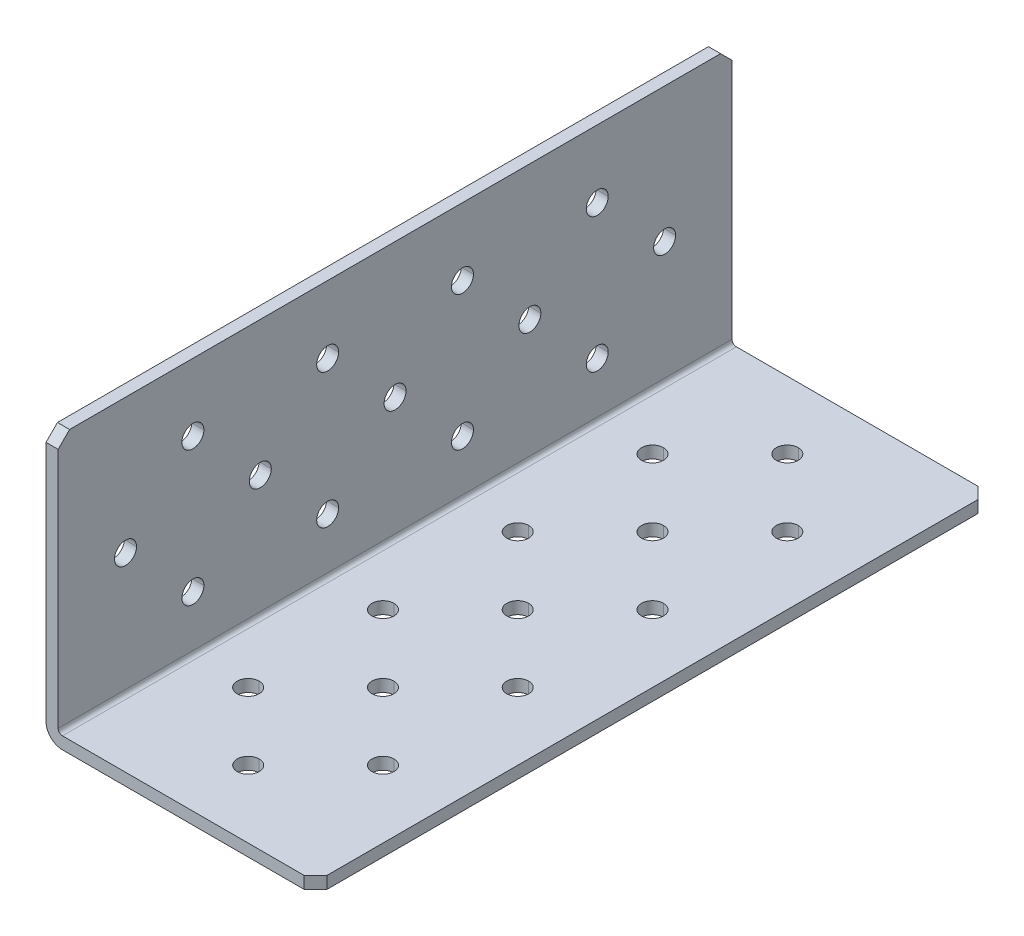
from build123d import *

# Parameters (mm, degrees)
CUT_EXTRUDE1_OUTLINE_R   = 2.0701
CUT_EXTRUDE1_DEPTH       = 3.0988
CUT_EXTRUDE1_START       = 2.286
CUT_EXTRUDE1_2_OUTLINE_W = 2.286
CUT_EXTRUDE1_2_OUTLINE_H = 152.4
CUT_EXTRUDE1_2_DEPTH     = 48.514
CUT_EXTRUDE1_START_2     = 3.0988
CUT_EXTRUDE1_3_OUTLINE_W = 0.8128
CUT_EXTRUDE1_3_OUTLINE_H = 152.4
CUT_EXTRUDE1_3_DEPTH     = 47.7012
CUT_EXTRUDE1_4_OUTLINE_R = 2.0701
CUT_EXTRUDE1_4_DEPTH     = 2.286
CUT_EXTRUDE1_START_3     = -749.3
CUT_EXTRUDE1_5_DEPTH     = 152.4
CUT_EXTRUDE1_START_4     = 564.229492087
CUT_EXTRUDE1_6_OUTLINE_W = 5
CUT_EXTRUDE1_6_OUTLINE_H = 6
CUT_EXTRUDE1_6_DEPTH     = 2.770507913
CHAMFER1_SIZE            = 2.159
BOSS_EXTRUDE1_START      = -2.286
BOSS_EXTRUDE1_DEPTH      = 2.286
BOSS_EXTRUDE2_START      = -2.286
BOSS_EXTRUDE2_DEPTH      = 2.286
SKETCH4_W                = 50.8
SKETCH4_H                = 50.8
CUT_EXTRUDE2_DEPTH       = 12.7
SKETCH5_W                = 50.8
SKETCH5_H                = 50.8
CUT_EXTRUDE3_DEPTH       = 12.7
BOSS_EXTRUDE3_START      = -2.286
BOSS_EXTRUDE3_DEPTH      = 2.286
BOSS_EXTRUDE4_START      = -2.286
BOSS_EXTRUDE4_DEPTH      = 2.286
CHAMFER2_SIZE            = 2.159


with BuildPart() as part:
    # Cut-Extrude1: read off the stored shape, not the designer's step
    # Cut-Extrude1 outline → Cut-Extrude1 (new body)
    with BuildSketch(Plane(origin=(0, 0, 0), x_dir=(1, 0, 0), z_dir=(0, 1, 0))):
        with BuildLine():
            ThreePointArc((23.3299, 596.9), (23.936218252, 598.363781748), (25.4, 598.9701))
            ThreePointArc((25.4, 598.9701), (26.863781748, 598.363781748), (27.4701, 596.9))
            Line((27.4701, 596.9), (50.8, 596.9))
            Line((50.8, 596.9), (50.8, 747.141))
            Line((50.8, 747.141), (48.641, 749.3))
            Line((48.641, 749.3), (0, 749.3))
            Line((0, 749.3), (0, 596.9))
            Line((0, 596.9), (23.3299, 596.9))
        make_face()
        with Locations((12.7, 609.6)):
            Circle(CUT_EXTRUDE1_OUTLINE_R, mode=Mode.SUBTRACT)
        with Locations((25.4, 622.3)):
            Circle(CUT_EXTRUDE1_OUTLINE_R, mode=Mode.SUBTRACT)
        with Locations((12.7, 635)):
            Circle(CUT_EXTRUDE1_OUTLINE_R, mode=Mode.SUBTRACT)
        with Locations((12.7, 660.4)):
            Circle(CUT_EXTRUDE1_OUTLINE_R, mode=Mode.SUBTRACT)
        with Locations((25.4, 647.7)):
            Circle(CUT_EXTRUDE1_OUTLINE_R, mode=Mode.SUBTRACT)
        with Locations((38.1, 609.6)):
            Circle(CUT_EXTRUDE1_OUTLINE_R, mode=Mode.SUBTRACT)
        with Locations((38.1, 635)):
            Circle(CUT_EXTRUDE1_OUTLINE_R, mode=Mode.SUBTRACT)
        with Locations((38.1, 660.4)):
            Circle(CUT_EXTRUDE1_OUTLINE_R, mode=Mode.SUBTRACT)
        with Locations((12.7, 685.8)):
            Circle(CUT_EXTRUDE1_OUTLINE_R, mode=Mode.SUBTRACT)
        with Locations((25.4, 673.1)):
            Circle(CUT_EXTRUDE1_OUTLINE_R, mode=Mode.SUBTRACT)
        with Locations((25.4, 698.5)):
            Circle(CUT_EXTRUDE1_OUTLINE_R, mode=Mode.SUBTRACT)
        with Locations((12.7, 711.2)):
            Circle(CUT_EXTRUDE1_OUTLINE_R, mode=Mode.SUBTRACT)
        with Locations((12.7, 736.6)):
            Circle(CUT_EXTRUDE1_OUTLINE_R, mode=Mode.SUBTRACT)
        with Locations((25.4, 723.9)):
            Circle(CUT_EXTRUDE1_OUTLINE_R, mode=Mode.SUBTRACT)
        with Locations((38.1, 685.8)):
            Circle(CUT_EXTRUDE1_OUTLINE_R, mode=Mode.SUBTRACT)
        with Locations((38.1, 711.2)):
            Circle(CUT_EXTRUDE1_OUTLINE_R, mode=Mode.SUBTRACT)
        with Locations((38.1, 736.6)):
            Circle(CUT_EXTRUDE1_OUTLINE_R, mode=Mode.SUBTRACT)
    extrude(amount=CUT_EXTRUDE1_DEPTH)

    # Cut-Extrude1 2 outline → Cut-Extrude1 2 (add)
    with BuildSketch(Plane(origin=(0, 0, 0), x_dir=(1, 0, 0), z_dir=(0, 1, 0)).offset(CUT_EXTRUDE1_START)):
        with Locations((1.143, 673.1)):
            Rectangle(CUT_EXTRUDE1_2_OUTLINE_W, CUT_EXTRUDE1_2_OUTLINE_H)
    extrude(amount=CUT_EXTRUDE1_2_DEPTH)

    # Cut-Extrude1 3 outline → Cut-Extrude1 3 (cut)
    with BuildSketch(Plane.YZ.offset(CUT_EXTRUDE1_START_2)):
        with Locations((2.6924, -673.1)):
            Rectangle(CUT_EXTRUDE1_3_OUTLINE_W, CUT_EXTRUDE1_3_OUTLINE_H)
    extrude(amount=CUT_EXTRUDE1_3_DEPTH, mode=Mode.SUBTRACT)

    # Cut-Extrude1 4 outline → Cut-Extrude1 4 (cut)
    with BuildSketch(Plane.YZ):
        with BuildLine():
            ThreePointArc((23.3299, -596.9), (23.936218252, -598.363781748), (25.4, -598.9701))
            ThreePointArc((25.4, -598.9701), (26.863781748, -598.363781748), (27.4701, -596.9))
            Line((27.4701, -596.9), (23.3299, -596.9))
        make_face()
        with Locations((25.4, -723.9)):
            Circle(CUT_EXTRUDE1_4_OUTLINE_R)
        with Locations((25.4, -698.5)):
            Circle(CUT_EXTRUDE1_4_OUTLINE_R)
        with Locations((25.4, -673.1)):
            Circle(CUT_EXTRUDE1_4_OUTLINE_R)
        with Locations((25.4, -647.7)):
            Circle(CUT_EXTRUDE1_4_OUTLINE_R)
        with Locations((25.4, -622.3)):
            Circle(CUT_EXTRUDE1_4_OUTLINE_R)
        with Locations((12.7, -736.6)):
            Circle(CUT_EXTRUDE1_4_OUTLINE_R)
        with Locations((12.7, -711.2)):
            Circle(CUT_EXTRUDE1_4_OUTLINE_R)
        with Locations((12.7, -685.8)):
            Circle(CUT_EXTRUDE1_4_OUTLINE_R)
        with Locations((12.7, -660.4)):
            Circle(CUT_EXTRUDE1_4_OUTLINE_R)
        with Locations((12.7, -635)):
            Circle(CUT_EXTRUDE1_4_OUTLINE_R)
        with Locations((12.7, -609.6)):
            Circle(CUT_EXTRUDE1_4_OUTLINE_R)
        with Locations((38.1, -736.6)):
            Circle(CUT_EXTRUDE1_4_OUTLINE_R)
        with Locations((38.1, -711.2)):
            Circle(CUT_EXTRUDE1_4_OUTLINE_R)
        with Locations((38.1, -685.8)):
            Circle(CUT_EXTRUDE1_4_OUTLINE_R)
        with Locations((38.1, -660.4)):
            Circle(CUT_EXTRUDE1_4_OUTLINE_R)
        with Locations((38.1, -635)):
            Circle(CUT_EXTRUDE1_4_OUTLINE_R)
        with Locations((38.1, -609.6)):
            Circle(CUT_EXTRUDE1_4_OUTLINE_R)
    extrude(amount=CUT_EXTRUDE1_4_DEPTH, mode=Mode.SUBTRACT)

    # Cut-Extrude1 5 outline → Cut-Extrude1 5 (cut)
    with BuildSketch(Plane.XY.offset(CUT_EXTRUDE1_START_3)):
        with BuildLine():
            ThreePointArc((3.0988, 0), (0.907617506, 0.907617506), (0, 3.0988))
            Line((0, 3.0988), (2.4e-08, 50))
            Line((2.4e-08, 50), (-1, 50))
            Line((-1, 50), (-1, -1))
            Line((-1, -1), (5, -1))
            Line((5, -1), (5, 1e-09))
            Line((5, 1e-09), (3.0988, 0))
        make_face()
        with BuildLine():
            Line((3.0988, 3.0988), (2.286, 3.0988))
            ThreePointArc((2.286, 3.0988), (2.524063608, 2.524063608), (3.0988, 2.286))
            Line((3.0988, 2.286), (3.0988, 3.0988))
        make_face()
    extrude(amount=CUT_EXTRUDE1_5_DEPTH, mode=Mode.SUBTRACT)

    # Cut-Extrude1 6 outline → Cut-Extrude1 6 (cut)
    with BuildSketch(Plane(origin=(0, 0, 0), x_dir=(1, 0, 0), z_dir=(0, 0.7071067811865511, -0.7071067811865441)).offset(CUT_EXTRUDE1_START_4)):
        with Locations((1.5, 494)):
            Rectangle(CUT_EXTRUDE1_6_OUTLINE_W, CUT_EXTRUDE1_6_OUTLINE_H)
    extrude(amount=CUT_EXTRUDE1_6_DEPTH, mode=Mode.SUBTRACT)

    # Chamfer1
    chamfer1_edges = [part.edges().sort_by_distance(p)[0] for p in [
        (1.143, 50.8, -596.9),
        (50.8, 1.143, -596.9),
    ]]
    chamfer(chamfer1_edges, length=CHAMFER1_SIZE)

    # Sketch2 → Boss-Extrude1 (add)
    with BuildSketch(Plane(origin=(2.286, 0, 0), x_dir=(0, 0, -1), z_dir=(1, 0, 0)).offset(BOSS_EXTRUDE1_START)):
        with BuildLine():
            Line((596.9, 27.4701), (596.9, 23.3299))
            ThreePointArc((596.9, 23.3299), (598.9701, 25.4), (596.9, 27.4701))
        make_face()
    extrude(amount=BOSS_EXTRUDE1_DEPTH)

    # Sketch3 → Boss-Extrude2 (add)
    with BuildSketch(Plane(origin=(0, 2.286, 0), x_dir=(1, 0, 0), z_dir=(0, 1, 0)).offset(BOSS_EXTRUDE2_START)):
        with BuildLine():
            Line((27.4701, 596.9), (23.3299, 596.9))
            ThreePointArc((23.3299, 596.9), (25.4, 598.9701), (27.4701, 596.9))
        make_face()
    extrude(amount=BOSS_EXTRUDE2_DEPTH)

    # Sketch4 → Cut-Extrude2 (cut)
    with BuildSketch(Plane.XY.offset(-596.9)):
        with Locations((25.4, 25.4)):
            Rectangle(SKETCH4_W, SKETCH4_H)
    extrude(amount=-CUT_EXTRUDE2_DEPTH, mode=Mode.SUBTRACT)

    # Sketch5 → Cut-Extrude3 (cut)
    with BuildSketch(Plane(origin=(0, 0, -749.3), x_dir=(-1, 0, 0), z_dir=(0, 0, -1))):
        with Locations((-25.4, 25.4)):
            Rectangle(SKETCH5_W, SKETCH5_H)
    extrude(amount=-CUT_EXTRUDE3_DEPTH, mode=Mode.SUBTRACT)

    # Sketch6 → Boss-Extrude3 (add)
    with BuildSketch(Plane(origin=(0, 2.286, 0), x_dir=(1, 0, 0), z_dir=(0, 1, 0)).offset(BOSS_EXTRUDE3_START)):
        with BuildLine():
            Line((40.1701, 609.6), (36.0299, 609.6))
            ThreePointArc((36.0299, 609.6), (36.636218252, 611.063781748), (38.1, 611.6701))
            ThreePointArc((38.1, 611.6701), (39.563781748, 611.063781748), (40.1701, 609.6))
        make_face()
        with BuildLine():
            Line((14.7701, 609.6), (10.6299, 609.6))
            ThreePointArc((10.6299, 609.6), (11.236218252, 611.063781748), (12.7, 611.6701))
            ThreePointArc((12.7, 611.6701), (14.163781748, 611.063781748), (14.7701, 609.6))
        make_face()
        with BuildLine():
            Line((40.1701, 736.6), (36.0299, 736.6))
            ThreePointArc((36.0299, 736.6), (36.636218252, 735.136218252), (38.1, 734.5299))
            ThreePointArc((38.1, 734.5299), (39.563781748, 735.136218252), (40.1701, 736.6))
        make_face()
        with BuildLine():
            Line((14.7701, 736.6), (10.6299, 736.6))
            ThreePointArc((10.6299, 736.6), (11.236218252, 735.136218252), (12.7, 734.5299))
            ThreePointArc((12.7, 734.5299), (14.163781748, 735.136218252), (14.7701, 736.6))
        make_face()
    extrude(amount=BOSS_EXTRUDE3_DEPTH)

    # Sketch7 → Boss-Extrude4 (add)
    with BuildSketch(Plane(origin=(2.286, 0, 0), x_dir=(0, 0, -1), z_dir=(1, 0, 0)).offset(BOSS_EXTRUDE4_START)):
        with BuildLine():
            Line((736.6, 10.6299), (736.6, 14.7701))
            ThreePointArc((736.6, 14.7701), (735.136218252, 14.163781748), (734.5299, 12.7))
            ThreePointArc((734.5299, 12.7), (735.136218252, 11.236218252), (736.6, 10.6299))
        make_face()
        with BuildLine():
            Line((736.6, 36.0299), (736.6, 40.1701))
            ThreePointArc((736.6, 40.1701), (735.136218252, 39.563781748), (734.5299, 38.1))
            ThreePointArc((734.5299, 38.1), (735.136218252, 36.636218252), (736.6, 36.0299))
        make_face()
        with BuildLine():
            Line((609.6, 10.6299), (609.6, 14.7701))
            ThreePointArc((609.6, 14.7701), (611.063781748, 14.163781748), (611.6701, 12.7))
            ThreePointArc((611.6701, 12.7), (611.063781748, 11.236218252), (609.6, 10.6299))
        make_face()
        with BuildLine():
            Line((609.6, 36.0299), (609.6, 40.1701))
            ThreePointArc((609.6, 40.1701), (611.063781748, 39.563781748), (611.6701, 38.1))
            ThreePointArc((611.6701, 38.1), (611.063781748, 36.636218252), (609.6, 36.0299))
        make_face()
    extrude(amount=BOSS_EXTRUDE4_DEPTH)

    # Chamfer2
    chamfer2_edges = [part.edges().sort_by_distance(p)[0] for p in [
        (50.8, 1.143, -609.6),
        (1.143, 50.8, -609.6),
        (1.143, 50.8, -736.6),
        (50.8, 1.143, -736.6),
    ]]
    chamfer(chamfer2_edges, length=CHAMFER2_SIZE)


solid = part.part
